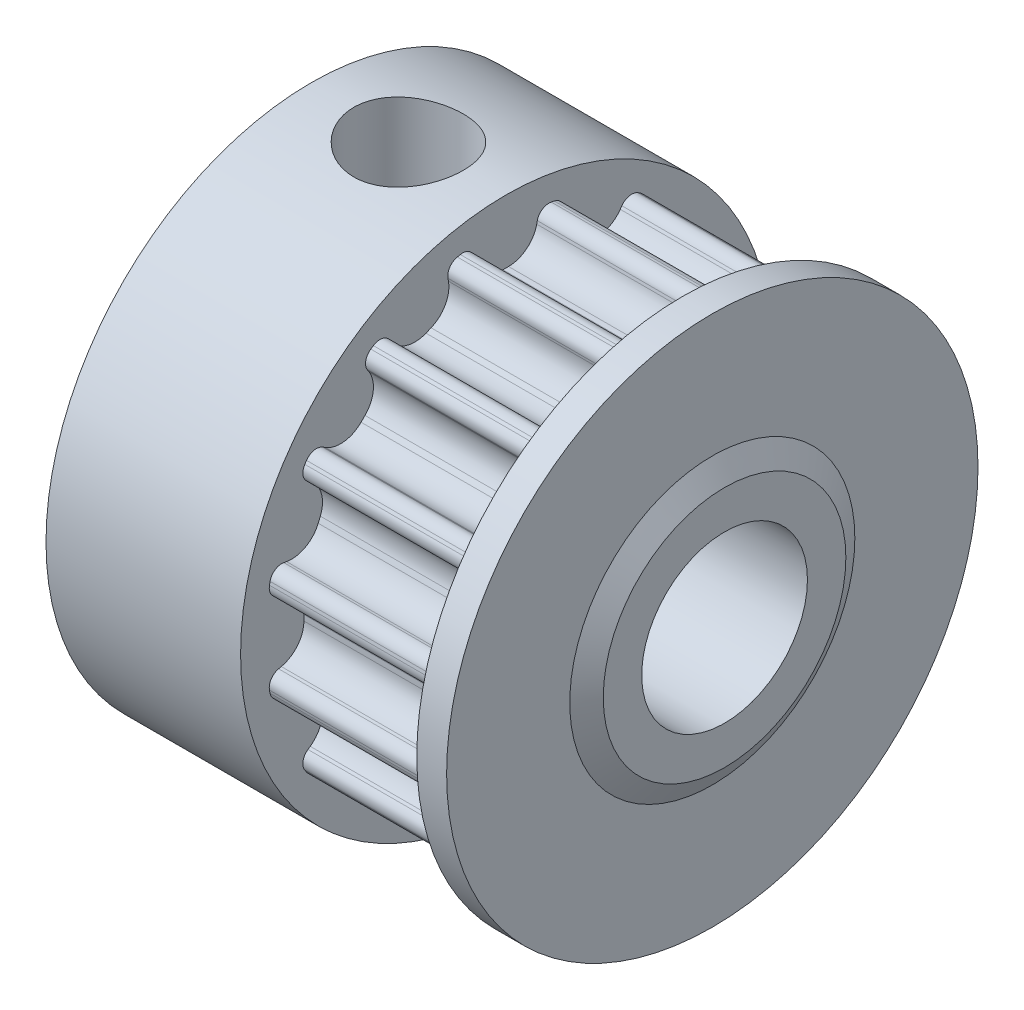
from build123d import *

# Parameters (mm, degrees)
ESTRUSIONE_ESTRUSIONE1_DEPTH   = 5.33
SCHIZZO3_R                     = 8.015
ESTRUSIONE_ESTRUSIONE2_DEPTH   = 0.9
SCHIZZO4_R                     = 8
ESTRUSIONE_ESTRUSIONE3_DEPTH   = 5.87
SCHIZZO5_R                     = 4.3
ESTRUSIONE_ESTRUSIONE4_DEPTH   = 0.37
SMUSSO1_SIZE2                  = 0.640858799
SMUSSO1_SIZE                   = 0.37
SCHIZZO6_R                     = 2.5
TAGLIO_ESTRUSIONE1_DEPTH       = 17.8517462
FORO_FILETTATO_M4X0_7_1_REACH  = 21.086
FORO_FILETTATO_M4X0_7_1_BORE_R = 1.65


with BuildPart() as part:
    # Schizzo2 → Estrusione-Estrusione1 (new body)
    with BuildSketch(Plane(origin=(0, 0, 0), x_dir=(0, 0, -1), z_dir=(1, 0, 0))):
        with BuildLine():
            Line((6.09, -0.083490418), (6.09, 0.083490418))
            ThreePointArc((6.09, 0.083490418), (6.258287756, 0.597785981), (6.698045807, 0.91311684))
            ThreePointArc((6.698045807, 0.91311684), (6.734655239, 0.923799729), (6.771697669, 0.932867973))
            Line((6.771697669, 0.932867973), (6.853858314, 0.951082537))
            ThreePointArc((6.853858314, 0.951082537), (7.076798589, 1.104851798), (7.129467527, 1.370508219))
            ThreePointArc((7.129467527, 1.370508219), (7.120501136, 1.416355738), (7.111239916, 1.462144611))
            ThreePointArc((7.111239916, 1.462144611), (6.960917894, 1.687423582), (6.696103049, 1.744172354))
            Line((6.696103049, 1.744172354), (6.613225995, 1.72955888))
            ThreePointArc((6.613225995, 1.72955888), (6.575532985, 1.723761321), (6.537622116, 1.7196212))
            ThreePointArc((6.537622116, 1.7196212), (6.010666757, 1.842660807), (5.658376753, 2.253407015))
            Line((5.658376753, 2.253407015), (5.594475953, 2.407677191))
            ThreePointArc((5.594475953, 2.407677191), (5.553141175, 2.947225272), (5.838752743, 3.406841119))
            ThreePointArc((5.838752743, 3.406841119), (5.868487283, 3.430720645), (5.899239759, 3.453274134))
            Line((5.899239759, 3.453274134), (5.968175886, 3.501543714))
            ThreePointArc((5.968175886, 3.501543714), (6.115300894, 3.728923536), (6.062298336, 3.994513597))
            ThreePointArc((6.062298336, 3.994513597), (6.036469385, 4.033439892), (6.01039049, 4.072199179))
            ThreePointArc((6.01039049, 4.072199179), (5.785300521, 4.222804062), (5.518926692, 4.173892837))
            Line((5.518926692, 4.173892837), (5.447950612, 4.128676072))
            ThreePointArc((5.447950612, 4.128676072), (5.415345442, 4.108895336), (5.381904721, 4.090562501))
            ThreePointArc((5.381904721, 4.090562501), (4.847976231, 4.00257919), (4.365316938, 4.247243657))
            Line((4.365316938, 4.247243657), (4.247243657, 4.365316938))
            ThreePointArc((4.247243657, 4.365316938), (4.00257919, 4.847976231), (4.090562501, 5.381904721))
            ThreePointArc((4.090562501, 5.381904721), (4.108895336, 5.415345442), (4.128676072, 5.447950612))
            Line((4.128676072, 5.447950612), (4.17389278, 5.518926602))
            ThreePointArc((4.17389278, 5.518926602), (4.222804073, 5.785300469), (4.072199179, 6.01039049))
            ThreePointArc((4.072199179, 6.01039049), (4.033439892, 6.036469385), (3.994513597, 6.062298336))
            ThreePointArc((3.994513597, 6.062298336), (3.728923588, 6.115300904), (3.501543775, 5.968175973))
            Line((3.501543775, 5.968175973), (3.453274134, 5.899239759))
            ThreePointArc((3.453274134, 5.899239759), (3.430720645, 5.868487283), (3.406841119, 5.838752743))
            ThreePointArc((3.406841119, 5.838752743), (2.947225272, 5.553141175), (2.407677191, 5.594475953))
            Line((2.407677191, 5.594475953), (2.253407015, 5.658376753))
            ThreePointArc((2.253407015, 5.658376753), (1.842660807, 6.010666757), (1.7196212, 6.537622116))
            ThreePointArc((1.7196212, 6.537622116), (1.723761321, 6.575532985), (1.72955888, 6.613225995))
            Line((1.72955888, 6.613225995), (1.744172335, 6.696102945))
            ThreePointArc((1.744172335, 6.696102945), (1.687423612, 6.96091785), (1.462144611, 7.111239916))
            ThreePointArc((1.462144611, 7.111239916), (1.416355738, 7.120501136), (1.370508219, 7.129467527))
            ThreePointArc((1.370508219, 7.129467527), (1.104851842, 7.076798618), (0.951082559, 6.853858418))
            Line((0.951082559, 6.853858418), (0.932867973, 6.771697669))
            ThreePointArc((0.932867973, 6.771697669), (0.923799729, 6.734655239), (0.91311684, 6.698045807))
            ThreePointArc((0.91311684, 6.698045807), (0.597785981, 6.258287756), (0.083490418, 6.09))
            Line((0.083490418, 6.09), (-0.083490418, 6.09))
            ThreePointArc((-0.083490418, 6.09), (-0.597785981, 6.258287756), (-0.91311684, 6.698045807))
            ThreePointArc((-0.91311684, 6.698045807), (-0.923799729, 6.734655239), (-0.932867973, 6.771697669))
            Line((-0.932867973, 6.771697669), (-0.951082537, 6.853858314))
            ThreePointArc((-0.951082537, 6.853858314), (-1.104851798, 7.076798589), (-1.370508219, 7.129467527))
            ThreePointArc((-1.370508219, 7.129467527), (-1.416355738, 7.120501136), (-1.462144611, 7.111239916))
            ThreePointArc((-1.462144611, 7.111239916), (-1.687423582, 6.960917894), (-1.744172354, 6.696103049))
            Line((-1.744172354, 6.696103049), (-1.72955888, 6.613225995))
            ThreePointArc((-1.72955888, 6.613225995), (-1.723761321, 6.575532985), (-1.7196212, 6.537622116))
            ThreePointArc((-1.7196212, 6.537622116), (-1.842660807, 6.010666757), (-2.253407015, 5.658376753))
            Line((-2.253407015, 5.658376753), (-2.407677191, 5.594475953))
            ThreePointArc((-2.407677191, 5.594475953), (-2.947225272, 5.553141175), (-3.406841119, 5.838752743))
            ThreePointArc((-3.406841119, 5.838752743), (-3.430720645, 5.868487283), (-3.453274134, 5.899239759))
            Line((-3.453274134, 5.899239759), (-3.501543714, 5.968175886))
            ThreePointArc((-3.501543714, 5.968175886), (-3.728923536, 6.115300894), (-3.994513597, 6.062298336))
            ThreePointArc((-3.994513597, 6.062298336), (-4.033439892, 6.036469385), (-4.072199179, 6.01039049))
            ThreePointArc((-4.072199179, 6.01039049), (-4.222804062, 5.785300521), (-4.173892837, 5.518926692))
            Line((-4.173892837, 5.518926692), (-4.128676072, 5.447950612))
            ThreePointArc((-4.128676072, 5.447950612), (-4.108895336, 5.415345442), (-4.090562501, 5.381904721))
            ThreePointArc((-4.090562501, 5.381904721), (-4.00257919, 4.847976231), (-4.247243657, 4.365316938))
            Line((-4.247243657, 4.365316938), (-4.365316938, 4.247243657))
            ThreePointArc((-4.365316938, 4.247243657), (-4.847976231, 4.00257919), (-5.381904721, 4.090562501))
            ThreePointArc((-5.381904721, 4.090562501), (-5.415345442, 4.108895336), (-5.447950612, 4.128676072))
            Line((-5.447950612, 4.128676072), (-5.518926602, 4.17389278))
            ThreePointArc((-5.518926602, 4.17389278), (-5.785300469, 4.222804073), (-6.01039049, 4.072199179))
            ThreePointArc((-6.01039049, 4.072199179), (-6.036469385, 4.033439892), (-6.062298336, 3.994513597))
            ThreePointArc((-6.062298336, 3.994513597), (-6.115300904, 3.728923588), (-5.968175973, 3.501543775))
            Line((-5.968175973, 3.501543775), (-5.899239759, 3.453274134))
            ThreePointArc((-5.899239759, 3.453274134), (-5.868487283, 3.430720645), (-5.838752743, 3.406841119))
            ThreePointArc((-5.838752743, 3.406841119), (-5.553141175, 2.947225272), (-5.594475953, 2.407677191))
            Line((-5.594475953, 2.407677191), (-5.658376753, 2.253407015))
            ThreePointArc((-5.658376753, 2.253407015), (-6.010666757, 1.842660807), (-6.537622116, 1.7196212))
            ThreePointArc((-6.537622116, 1.7196212), (-6.575532985, 1.723761321), (-6.613225995, 1.72955888))
            Line((-6.613225995, 1.72955888), (-6.696102945, 1.744172335))
            ThreePointArc((-6.696102945, 1.744172335), (-6.96091785, 1.687423612), (-7.111239916, 1.462144611))
            ThreePointArc((-7.111239916, 1.462144611), (-7.120501136, 1.416355738), (-7.129467527, 1.370508219))
            ThreePointArc((-7.129467527, 1.370508219), (-7.076798618, 1.104851842), (-6.853858418, 0.951082559))
            Line((-6.853858418, 0.951082559), (-6.771697669, 0.932867973))
            ThreePointArc((-6.771697669, 0.932867973), (-6.734655239, 0.923799729), (-6.698045807, 0.91311684))
            ThreePointArc((-6.698045807, 0.91311684), (-6.258287756, 0.597785981), (-6.09, 0.083490418))
            Line((-6.09, 0.083490418), (-6.09, -0.083490418))
            ThreePointArc((-6.09, -0.083490418), (-6.258287756, -0.597785981), (-6.698045807, -0.91311684))
            ThreePointArc((-6.698045807, -0.91311684), (-6.734655239, -0.923799729), (-6.771697669, -0.932867973))
            Line((-6.771697669, -0.932867973), (-6.853858314, -0.951082537))
            ThreePointArc((-6.853858314, -0.951082537), (-7.076798589, -1.104851797), (-7.129467527, -1.370508219))
            ThreePointArc((-7.129467527, -1.370508219), (-7.120501136, -1.416355738), (-7.111239916, -1.462144611))
            ThreePointArc((-7.111239916, -1.462144611), (-6.960917894, -1.687423582), (-6.696103049, -1.744172354))
            Line((-6.696103049, -1.744172354), (-6.613225995, -1.72955888))
            ThreePointArc((-6.613225995, -1.72955888), (-6.575532985, -1.723761321), (-6.537622116, -1.7196212))
            ThreePointArc((-6.537622116, -1.7196212), (-6.010666757, -1.842660807), (-5.658376753, -2.253407015))
            Line((-5.658376753, -2.253407015), (-5.594475953, -2.407677191))
            ThreePointArc((-5.594475953, -2.407677191), (-5.553141175, -2.947225272), (-5.838752743, -3.406841119))
            ThreePointArc((-5.838752743, -3.406841119), (-5.868487283, -3.430720645), (-5.899239759, -3.453274134))
            Line((-5.899239759, -3.453274134), (-5.968175886, -3.501543714))
            ThreePointArc((-5.968175886, -3.501543714), (-6.115300894, -3.728923536), (-6.062298336, -3.994513597))
            ThreePointArc((-6.062298336, -3.994513597), (-6.036469385, -4.033439892), (-6.01039049, -4.072199179))
            ThreePointArc((-6.01039049, -4.072199179), (-5.785300521, -4.222804062), (-5.518926692, -4.173892837))
            Line((-5.518926692, -4.173892837), (-5.447950612, -4.128676072))
            ThreePointArc((-5.447950612, -4.128676072), (-5.415345442, -4.108895336), (-5.381904721, -4.090562501))
            ThreePointArc((-5.381904721, -4.090562501), (-4.847976231, -4.00257919), (-4.365316938, -4.247243657))
            Line((-4.365316938, -4.247243657), (-4.247243657, -4.365316938))
            ThreePointArc((-4.247243657, -4.365316938), (-4.00257919, -4.847976231), (-4.090562501, -5.381904721))
            ThreePointArc((-4.090562501, -5.381904721), (-4.108895336, -5.415345442), (-4.128676072, -5.447950612))
            Line((-4.128676072, -5.447950612), (-4.17389278, -5.518926602))
            ThreePointArc((-4.17389278, -5.518926602), (-4.222804073, -5.785300469), (-4.072199179, -6.01039049))
            ThreePointArc((-4.072199179, -6.01039049), (-4.033439892, -6.036469385), (-3.994513597, -6.062298336))
            ThreePointArc((-3.994513597, -6.062298336), (-3.728923588, -6.115300904), (-3.501543775, -5.968175973))
            Line((-3.501543775, -5.968175973), (-3.453274134, -5.899239759))
            ThreePointArc((-3.453274134, -5.899239759), (-3.430720645, -5.868487283), (-3.406841119, -5.838752743))
            ThreePointArc((-3.406841119, -5.838752743), (-2.947225272, -5.553141175), (-2.407677191, -5.594475953))
            Line((-2.407677191, -5.594475953), (-2.253407015, -5.658376753))
            ThreePointArc((-2.253407015, -5.658376753), (-1.842660807, -6.010666757), (-1.7196212, -6.537622116))
            ThreePointArc((-1.7196212, -6.537622116), (-1.723761321, -6.575532985), (-1.72955888, -6.613225995))
            Line((-1.72955888, -6.613225995), (-1.744172335, -6.696102945))
            ThreePointArc((-1.744172335, -6.696102945), (-1.687423612, -6.96091785), (-1.462144611, -7.111239916))
            ThreePointArc((-1.462144611, -7.111239916), (-1.416355738, -7.120501136), (-1.370508219, -7.129467527))
            ThreePointArc((-1.370508219, -7.129467527), (-1.104851842, -7.076798618), (-0.951082559, -6.853858418))
            Line((-0.951082559, -6.853858418), (-0.932867973, -6.771697669))
            ThreePointArc((-0.932867973, -6.771697669), (-0.923799729, -6.734655239), (-0.91311684, -6.698045807))
            ThreePointArc((-0.91311684, -6.698045807), (-0.597785981, -6.258287756), (-0.083490418, -6.09))
            Line((-0.083490418, -6.09), (0.083490418, -6.09))
            ThreePointArc((0.083490418, -6.09), (0.597785981, -6.258287756), (0.91311684, -6.698045807))
            ThreePointArc((0.91311684, -6.698045807), (0.923799729, -6.734655239), (0.932867973, -6.771697669))
            Line((0.932867973, -6.771697669), (0.951082537, -6.853858314))
            ThreePointArc((0.951082537, -6.853858314), (1.104851798, -7.076798589), (1.370508219, -7.129467527))
            ThreePointArc((1.370508219, -7.129467527), (1.416355738, -7.120501136), (1.462144611, -7.111239916))
            ThreePointArc((1.462144611, -7.111239916), (1.687423582, -6.960917894), (1.744172354, -6.696103049))
            Line((1.744172354, -6.696103049), (1.72955888, -6.613225995))
            ThreePointArc((1.72955888, -6.613225995), (1.723761321, -6.575532985), (1.7196212, -6.537622116))
            ThreePointArc((1.7196212, -6.537622116), (1.842660807, -6.010666757), (2.253407015, -5.658376753))
            Line((2.253407015, -5.658376753), (2.407677191, -5.594475953))
            ThreePointArc((2.407677191, -5.594475953), (2.947225272, -5.553141175), (3.406841119, -5.838752743))
            ThreePointArc((3.406841119, -5.838752743), (3.430720645, -5.868487283), (3.453274134, -5.899239759))
            Line((3.453274134, -5.899239759), (3.501543714, -5.968175886))
            ThreePointArc((3.501543714, -5.968175886), (3.728923536, -6.115300894), (3.994513597, -6.062298336))
            ThreePointArc((3.994513597, -6.062298336), (4.033439892, -6.036469385), (4.072199179, -6.01039049))
            ThreePointArc((4.072199179, -6.01039049), (4.222804062, -5.785300521), (4.173892837, -5.518926692))
            Line((4.173892837, -5.518926692), (4.128676072, -5.447950612))
            ThreePointArc((4.128676072, -5.447950612), (4.108895336, -5.415345442), (4.090562501, -5.381904721))
            ThreePointArc((4.090562501, -5.381904721), (4.00257919, -4.847976231), (4.247243657, -4.365316938))
            Line((4.247243657, -4.365316938), (4.365316938, -4.247243657))
            ThreePointArc((4.365316938, -4.247243657), (4.847976231, -4.00257919), (5.381904721, -4.090562501))
            ThreePointArc((5.381904721, -4.090562501), (5.415345442, -4.108895336), (5.447950612, -4.128676072))
            Line((5.447950612, -4.128676072), (5.518926602, -4.17389278))
            ThreePointArc((5.518926602, -4.17389278), (5.785300469, -4.222804073), (6.01039049, -4.072199179))
            ThreePointArc((6.01039049, -4.072199179), (6.036469385, -4.033439892), (6.062298336, -3.994513597))
            ThreePointArc((6.062298336, -3.994513597), (6.115300904, -3.728923588), (5.968175973, -3.501543775))
            Line((5.968175973, -3.501543775), (5.899239759, -3.453274134))
            ThreePointArc((5.899239759, -3.453274134), (5.868487283, -3.430720645), (5.838752743, -3.406841119))
            ThreePointArc((5.838752743, -3.406841119), (5.553141175, -2.947225272), (5.594475953, -2.407677191))
            Line((5.594475953, -2.407677191), (5.658376753, -2.253407015))
            ThreePointArc((5.658376753, -2.253407015), (6.010666757, -1.842660807), (6.537622116, -1.7196212))
            ThreePointArc((6.537622116, -1.7196212), (6.575532985, -1.723761321), (6.613225995, -1.72955888))
            Line((6.613225995, -1.72955888), (6.696102945, -1.744172335))
            ThreePointArc((6.696102945, -1.744172335), (6.96091785, -1.687423612), (7.111239916, -1.462144611))
            ThreePointArc((7.111239916, -1.462144611), (7.120501136, -1.416355738), (7.129467527, -1.370508219))
            ThreePointArc((7.129467527, -1.370508219), (7.076798618, -1.104851842), (6.853858418, -0.951082559))
            Line((6.853858418, -0.951082559), (6.771697669, -0.932867973))
            ThreePointArc((6.771697669, -0.932867973), (6.734655239, -0.923799729), (6.698045807, -0.91311684))
            ThreePointArc((6.698045807, -0.91311684), (6.258287756, -0.597785981), (6.09, -0.083490418))
        make_face()
    extrude(amount=ESTRUSIONE_ESTRUSIONE1_DEPTH)

    # Schizzo3 → Estrusione-Estrusione2 (add)
    with BuildSketch(Plane(origin=(5.33, 0, 0), x_dir=(0, 0, -1), z_dir=(1, 0, 0))):
        Circle(SCHIZZO3_R)
    extrude(amount=ESTRUSIONE_ESTRUSIONE2_DEPTH)

    # Schizzo4 → Estrusione-Estrusione3 (add)
    with BuildSketch(Plane.ZY):
        Circle(SCHIZZO4_R)
    extrude(amount=ESTRUSIONE_ESTRUSIONE3_DEPTH)

    # Schizzo5 → Estrusione-Estrusione4 (add)
    with BuildSketch(Plane(origin=(6.23, 0, 0), x_dir=(0, 0, -1), z_dir=(1, 0, 0))):
        Circle(SCHIZZO5_R)
    extrude(amount=ESTRUSIONE_ESTRUSIONE4_DEPTH)

    # Smusso1
    smusso1_edges = [part.edges().sort_by_distance(p)[0] for p in [
        (6.6, 0, 4.3),
    ]]
    smusso1_side = [part.faces().sort_by_distance(p)[0] for p in [
        (6.5926, 0, 4.3),
    ]]
    chamfer(smusso1_edges, length=SMUSSO1_SIZE - 0.0001, length2=SMUSSO1_SIZE2 - 0.0001, reference=smusso1_side[0])  # a hair under: the kernel refuses the full size

    # Schizzo6 → Taglio-Estrusione1 (cut, through all)
    with BuildSketch(Plane(origin=(6.6, 0, 0), x_dir=(0, 0, -1), z_dir=(1, 0, 0))):
        Circle(SCHIZZO6_R)
    extrude(amount=-TAGLIO_ESTRUSIONE1_DEPTH, mode=Mode.SUBTRACT)

    # Foro filettato M4x0.7-1 bore → Foro filettato M4x0.7-1 (cut, up to next)
    with BuildSketch(Plane(origin=(0, 8, 0), x_dir=(1, 0, 0), z_dir=(0, 1, 0)), mode=Mode.PRIVATE) as foro_filettato_m4x0_7_1_sk1:
        with Locations((-2.935, 0)):
            Circle(FORO_FILETTATO_M4X0_7_1_BORE_R)
    foro_filettato_m4x0_7_1_tool1 = extrude(foro_filettato_m4x0_7_1_sk1.sketch, amount=-FORO_FILETTATO_M4X0_7_1_REACH, mode=Mode.PRIVATE) & part.part
    add(foro_filettato_m4x0_7_1_tool1.solids().sort_by_distance((-2.935, 8, 0))[0], mode=Mode.SUBTRACT)


solid = part.part
